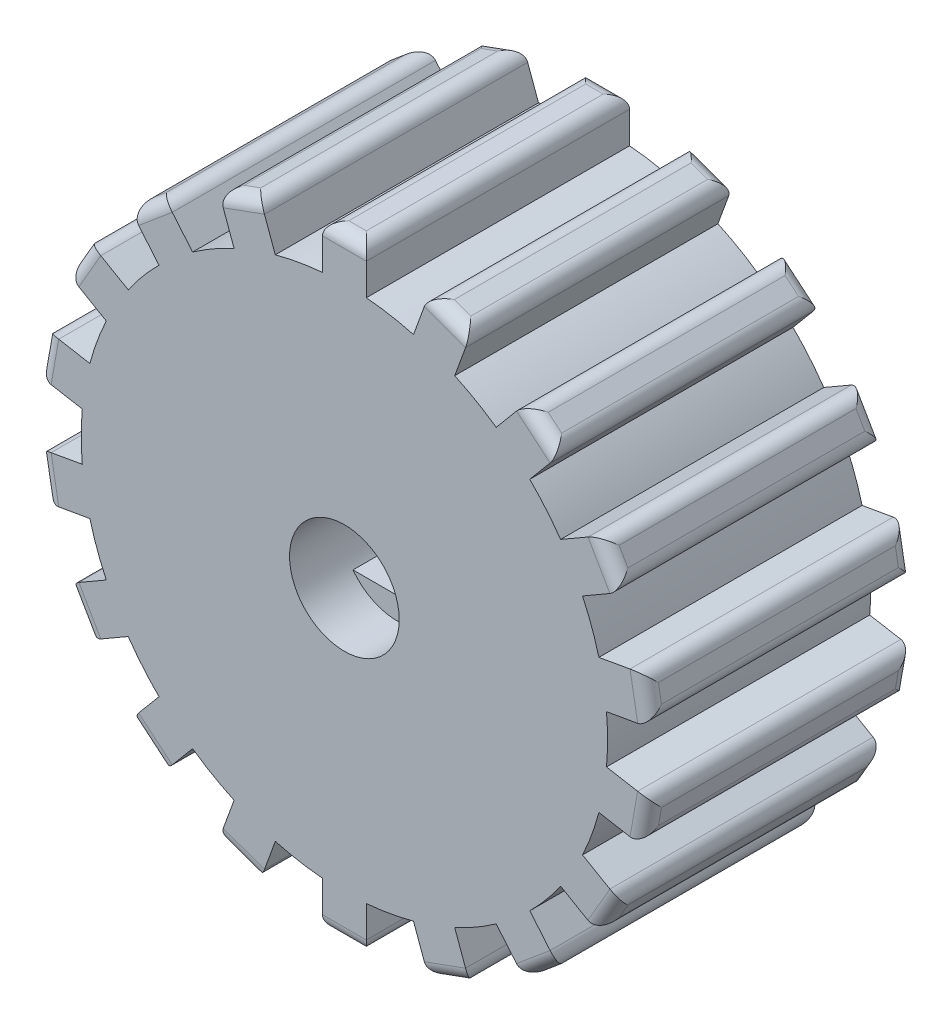
from build123d import *
from build123d.topology import SkipClean

# Parameters (mm, degrees)
SKETCH2_R                = 60
BOSS_EXTRUDE1_DEPTH      = 60
SKETCH3_W                = 10
SKETCH3_H                = 10.47851478
BOSS_EXTRUDE2_DEPTH      = 60
FILLET2_R                = 3
CIRPATTERN1_COUNT        = 18
FILLET2_OF_CIRPATTERN1_R = 3
SKETCH4_R                = 10
CUT_EXTRUDE1_DEPTH       = 60
SKETCH5_R                = 22.481820488
BOSS_EXTRUDE3_DEPTH      = 60
SKETCH6_R                = 12.5
CUT_EXTRUDE2_DEPTH       = 12
CUT_EXTRUDE3_DEPTH       = 30.5


with BuildPart() as part:
    # Sketch2 → Boss-Extrude1 (new body)
    with BuildSketch(Plane.XY):
        Circle(SKETCH2_R)
    extrude(amount=BOSS_EXTRUDE1_DEPTH)

    # Sketch3 → Boss-Extrude2 (add)
    with BuildSketch(Plane.XY.offset(60)):
        with Locations((0, 64.76074261)):
            Rectangle(SKETCH3_W, SKETCH3_H)
    boss_extrude2 = extrude(amount=-BOSS_EXTRUDE2_DEPTH)

    # Fillet2
    fillet2_edges = [part.edges().sort_by_distance(p)[0] for p in [
        (-5, 70, 30),
        (0, 70, 0),
        (5, 70, 30),
        (0, 70, 60),
    ]]
    fillet(fillet2_edges, radius=FILLET2_R)

    # CirPattern1: Boss-Extrude2 ×18 about axis
    cirpattern1_axis = Axis((0, 0, 60), (0, 0, -1))
    for i in range(1, CIRPATTERN1_COUNT):
        add(boss_extrude2.rotate(cirpattern1_axis, i * 360 / CIRPATTERN1_COUNT))

    # Fillet2 of CirPattern1
    fillet2_of_cirpattern1_edges = [part.edges().sort_by_distance(p)[0] for p in [
        (19.242946929, 67.488584172, 30),
        (23.941410033, 65.778483455, 0),
        (28.639873137, 64.068382738, 30),
        (23.941410033, 65.778483455, 60),
        (41.164910462, 56.837049067, 30),
        (44.995132678, 53.623111018, 0),
        (48.825354894, 50.40917297, 30),
        (44.995132678, 53.623111018, 60),
        (58.121778265, 39.330127019, 30),
        (60.621778265, 35, 0),
        (63.121778265, 30.669872981, 30),
        (60.621778265, 35, 60),
        (68.068301823, 17.079411202, 30),
        (68.936542711, 12.155372437, 0),
        (69.804783599, 7.231333672, 30),
        (68.936542711, 12.155372437, 60),
        (69.804783599, -7.231333672, 30),
        (68.936542711, -12.155372437, 0),
        (68.068301823, -17.079411202, 30),
        (68.936542711, -12.155372437, 60),
        (63.121778265, -30.669872981, 30),
        (60.621778265, -35, 0),
        (58.121778265, -39.330127019, 30),
        (60.621778265, -35, 60),
        (48.825354894, -50.40917297, 30),
        (44.995132678, -53.623111018, 0),
        (41.164910462, -56.837049067, 30),
        (44.995132678, -53.623111018, 60),
        (28.639873137, -64.068382738, 30),
        (23.941410033, -65.778483455, 0),
        (19.242946929, -67.488584172, 30),
        (23.941410033, -65.778483455, 60),
        (5, -70, 30),
        (0, -70, 0),
        (-5, -70, 30),
        (0, -70, 60),
        (-19.242946929, -67.488584172, 30),
        (-23.941410033, -65.778483455, 0),
        (-28.639873137, -64.068382738, 30),
        (-23.941410033, -65.778483455, 60),
        (-41.164910462, -56.837049067, 30),
        (-44.995132678, -53.623111018, 0),
        (-48.825354894, -50.40917297, 30),
        (-44.995132678, -53.623111018, 60),
        (-58.121778265, -39.330127019, 30),
        (-60.621778265, -35, 0),
        (-63.121778265, -30.669872981, 30),
        (-60.621778265, -35, 60),
        (-68.068301823, -17.079411202, 30),
        (-68.936542711, -12.155372437, 0),
        (-69.804783599, -7.231333672, 30),
        (-68.936542711, -12.155372437, 60),
        (-69.804783599, 7.231333672, 30),
        (-68.936542711, 12.155372437, 0),
        (-68.068301823, 17.079411202, 30),
        (-68.936542711, 12.155372437, 60),
        (-63.121778265, 30.669872981, 30),
        (-60.621778265, 35, 0),
        (-58.121778265, 39.330127019, 30),
        (-60.621778265, 35, 60),
        (-48.825354894, 50.40917297, 30),
        (-44.995132678, 53.623111018, 0),
        (-41.164910462, 56.837049067, 30),
        (-44.995132678, 53.623111018, 60),
        (-28.639873137, 64.068382738, 30),
        (-23.941410033, 65.778483455, 0),
        (-19.242946929, 67.488584172, 30),
        (-23.941410033, 65.778483455, 60),
    ]]
    fillet(fillet2_of_cirpattern1_edges, radius=FILLET2_OF_CIRPATTERN1_R)

    # Sketch4 → Cut-Extrude1 (cut)
    with BuildSketch(Plane.XY.offset(60)):
        Circle(SKETCH4_R)
    extrude(amount=-CUT_EXTRUDE1_DEPTH, mode=Mode.SUBTRACT)

    # Sketch5 → Boss-Extrude3 (add)
    with BuildSketch(Plane.XY.offset(60)):
        Circle(SKETCH5_R)
    extrude(amount=-BOSS_EXTRUDE3_DEPTH)

    # Sketch6 → Cut-Extrude2 (cut)
    with BuildSketch(Plane.XY.offset(60)):
        Circle(SKETCH6_R)
    extrude(amount=-CUT_EXTRUDE2_DEPTH, mode=Mode.SUBTRACT)

    # Sketch7 → Cut-Extrude3 (cut)
    with SkipClean():  # the faces are left unmerged after this step: merging them gives an invalid solid
        with BuildSketch(Plane.XY.offset(48)):
            with BuildLine():
                Line((10.037305415, -7.45), (-10.037305415, -7.45))
                ThreePointArc((-10.037305415, -7.45), (-12.5, 0), (-10.037305415, 7.45))
                Line((-10.037305415, 7.45), (10.037305415, 7.45))
                ThreePointArc((10.037305415, 7.45), (12.5, 0), (10.037305415, -7.45))
            make_face()
        extrude(amount=-CUT_EXTRUDE3_DEPTH, mode=Mode.SUBTRACT)


solid = part.part
